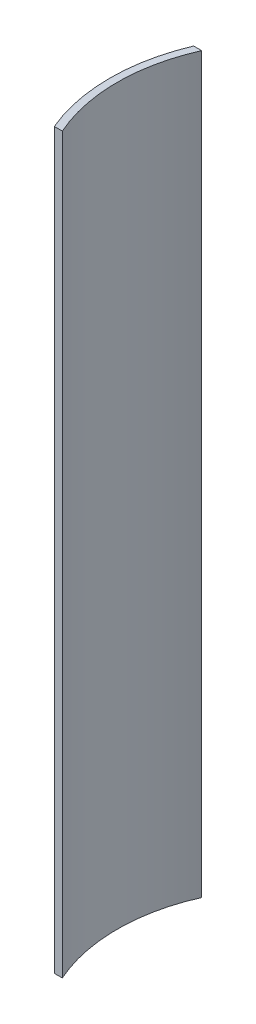
from build123d import *

# Parameters (mm, degrees)
SKETCH1_W           = 508
SKETCH1_H           = 241.3
BOSS_EXTRUDE1_DEPTH = 1270
CUT_EXTRUDE5_START  = -1270
CUT_EXTRUDE5_DEPTH  = 1270


# Read off the part's stored shape, not the designer's step: Cut-Extrude5
with BuildPart() as part:
    # Sketch1 → Boss-Extrude1 (new body)
    with BuildSketch(Plane(origin=(0, 0, 0), x_dir=(1, 0, 0), z_dir=(0, 1, 0))):
        with Locations((44.796719309, -28.633525346)):
            Rectangle(SKETCH1_W, SKETCH1_H)
    extrude(amount=BOSS_EXTRUDE1_DEPTH)

    # Cut-Extrude5 outline → Cut-Extrude5 (cut)
    with BuildSketch(Plane(origin=(0, 1270, 0), x_dir=(1, 0, 0), z_dir=(0, 1, 0)).offset(CUT_EXTRUDE5_START)):
        with BuildLine():
            Line((298.796719309, 92.016474654), (27.527020301, 92.016474654))
            ThreePointArc((27.527020301, 92.016474654), (1.906719309, -28.633525346), (27.527020301, -149.283525346))
            Line((27.527020301, -149.283525346), (298.796719309, -149.283525346))
            Line((298.796719309, -149.283525346), (298.796719309, 92.016474654))
        make_face()
        with BuildLine():
            ThreePointArc((13.683503901, -149.283525346), (-10.793280691, -28.633525346), (13.683503901, 92.016474654))
            Line((13.683503901, 92.016474654), (-209.203280691, 92.016474654))
            Line((-209.203280691, 92.016474654), (-209.203280691, -149.283525346))
            Line((-209.203280691, -149.283525346), (13.683503901, -149.283525346))
        make_face()
    extrude(amount=CUT_EXTRUDE5_DEPTH, mode=Mode.SUBTRACT)


solid = part.part
